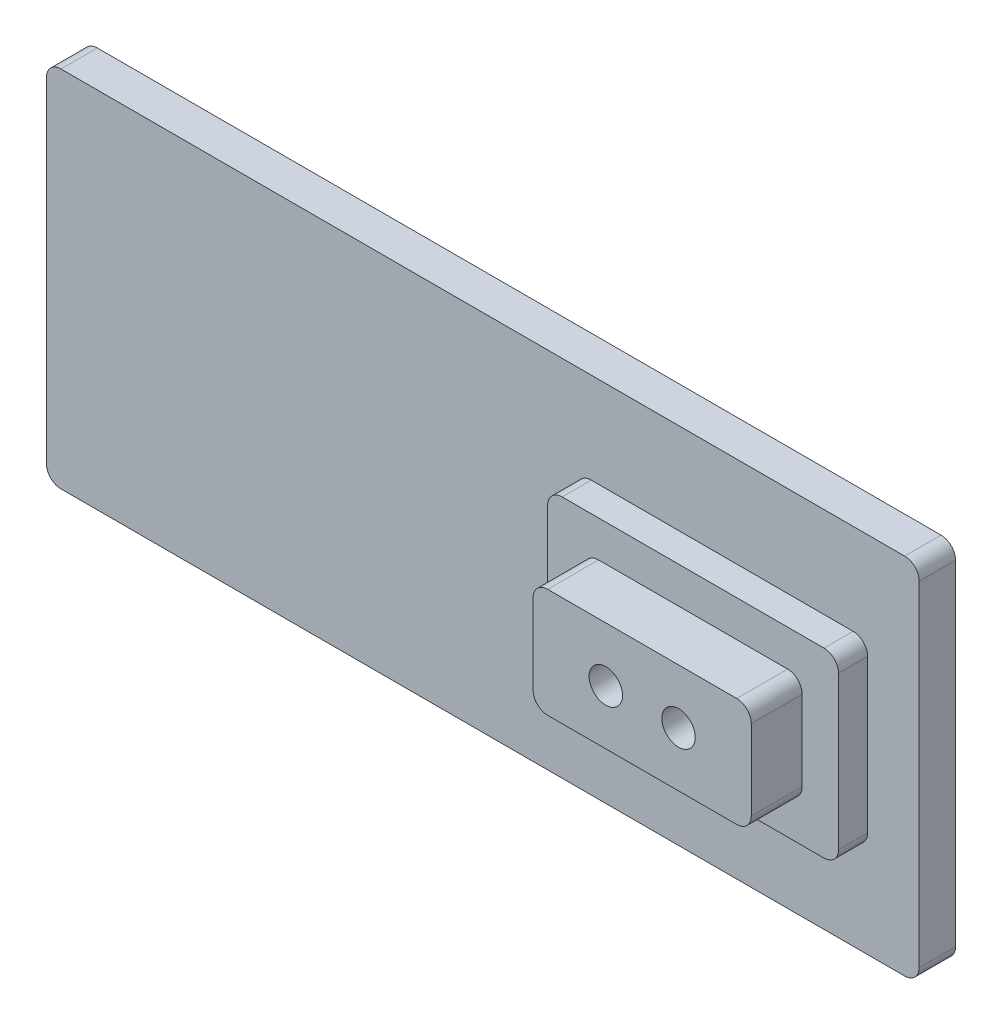
from build123d import *

# Parameters (mm, degrees)
CROQUIS1_W              = 30
CROQUIS1_H              = 15
CROQUIS1_R              = 2.3
SALIENTE_EXTRUIR1_DEPTH = 16
CROQUIS2_W              = 120
CROQUIS2_H              = 50
CROQUIS2_R              = 3.5
SALIENTE_EXTRUIR2_DEPTH = 5
CROQUIS3_W              = 40
CROQUIS3_H              = 25
CROQUIS3_W_2            = 30
CROQUIS3_H_2            = 15
SALIENTE_EXTRUIR3_DEPTH = 4
CORTAR_EXTRUIR1_DEPTH   = 5
REDONDEO1_R             = 2


with BuildPart() as part:
    # Croquis1 → Saliente-Extruir1 (new body)
    with BuildSketch(Plane.XY):
        Rectangle(CROQUIS1_W, CROQUIS1_H)
        with Locations((5, 0)):
            Circle(CROQUIS1_R, mode=Mode.SUBTRACT)
        with Locations((-5, 0)):
            Circle(CROQUIS1_R, mode=Mode.SUBTRACT)
    extrude(amount=SALIENTE_EXTRUIR1_DEPTH)

    # Croquis2 → Saliente-Extruir2 (add)
    with BuildSketch(Plane(origin=(0, 0, 0), x_dir=(-1, 0, 0), z_dir=(0, 0, -1))):
        with Locations((32.909933797, 0)):
            Rectangle(CROQUIS2_W, CROQUIS2_H)
        with Locations((-5, 0)):
            Circle(CROQUIS2_R, mode=Mode.SUBTRACT)
        with Locations((5, 0)):
            Circle(CROQUIS2_R, mode=Mode.SUBTRACT)
    extrude(amount=-SALIENTE_EXTRUIR2_DEPTH)

    # Croquis3 → Saliente-Extruir3 (add)
    with BuildSketch(Plane.XY.offset(5)):
        Rectangle(CROQUIS3_W, CROQUIS3_H)
        Rectangle(CROQUIS3_W_2, CROQUIS3_H_2, mode=Mode.SUBTRACT)
    extrude(amount=SALIENTE_EXTRUIR3_DEPTH)

    # Croquis4 → Cortar-Extruir1 (cut)
    with BuildSketch(Plane(origin=(0, 0, 0), x_dir=(-1, 0, 0), z_dir=(0, 0, -1))):
        with BuildLine():
            Line((5, 7.5), (-5, 7.5))
            ThreePointArc((-5, 7.5), (-12.5, 0), (-5, -7.5))
            Line((-5, -7.5), (5, -7.5))
            ThreePointArc((5, -7.5), (12.5, 0), (5, 7.5))
        make_face()
    extrude(amount=-CORTAR_EXTRUIR1_DEPTH, mode=Mode.SUBTRACT)

    # Redondeo1
    redondeo1_edges = [part.edges().sort_by_distance(p)[0] for p in [
        (15, -7.5, 12.5),
        (15, 7.5, 12.5),
        (-15, 7.5, 12.5),
        (-15, -7.5, 12.5),
        (-20, -12.5, 7),
        (20, -12.5, 7),
        (20, 12.5, 7),
        (-20, 12.5, 7),
        (-92.909933797, -25, 2.5),
        (-92.909933797, 25, 2.5),
        (27.090066203, -25, 2.5),
        (27.090066203, 25, 2.5),
    ]]
    fillet(redondeo1_edges, radius=REDONDEO1_R)


solid = part.part
